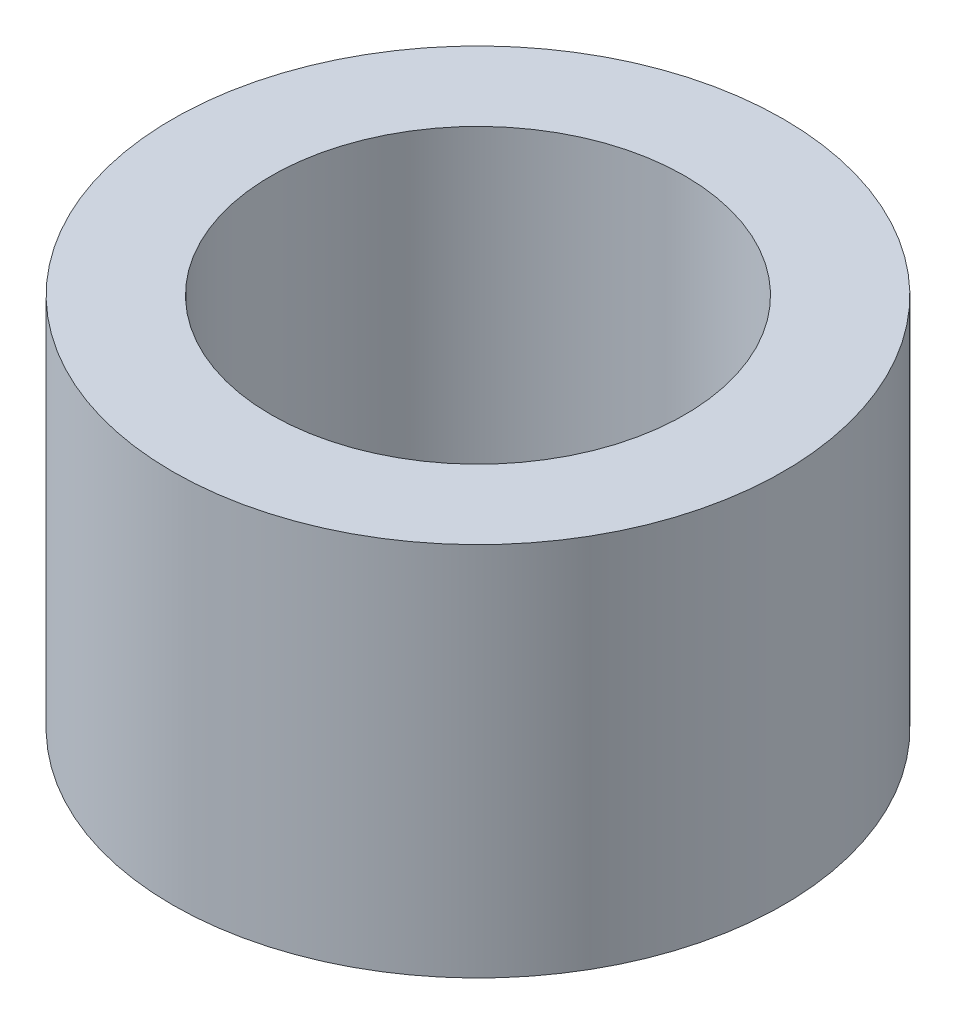
from build123d import *

# Parameters (mm, degrees)
SKETCH1_R           = 6.2
SKETCH1_R_2         = 4.2
BOSS_EXTRUDE1_DEPTH = 7.62


with BuildPart() as part:
    # Sketch1 → Boss-Extrude1 (new body)
    with BuildSketch(Plane(origin=(0, 0, 0), x_dir=(1, 0, 0), z_dir=(0, 1, 0))):
        Circle(SKETCH1_R)
        Circle(SKETCH1_R_2, mode=Mode.SUBTRACT)
    extrude(amount=BOSS_EXTRUDE1_DEPTH)


solid = part.part
